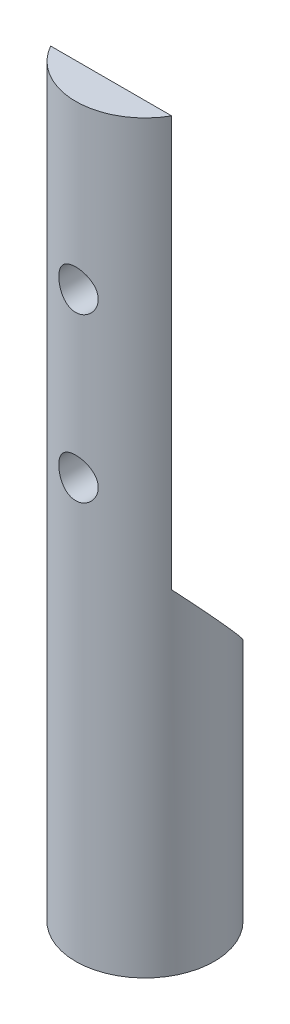
from build123d import *

# Parameters (mm, degrees)
SKETCH1_R               = 3.97129
BOSS_EXTRUDE1_DEPTH     = 42.672
CUT_EXTRUDE1_DEPTH      = 44.040003166
CUT_EXTRUDE1_DEPTH_BACK = 44.040003166
F_4_40_TAPPED_HOLE1_D   = 2.2606


with BuildPart() as part:
    # Sketch1 → Boss-Extrude1 (new body)
    with BuildSketch(Plane(origin=(0, 0, 0), x_dir=(1, 0, 0), z_dir=(0, 1, 0))):
        Circle(SKETCH1_R)
    extrude(amount=BOSS_EXTRUDE1_DEPTH)

    # Sketch2 → Cut-Extrude1 (cut, two sides: drawn at the far end of the back side and taken through both)
    with BuildSketch(Plane(origin=(0, 0, 0), x_dir=(0, 0, -1), z_dir=(1, 0, 0)).offset(-CUT_EXTRUDE1_DEPTH_BACK)):
        Polygon((-1.93929, 47.484126656), (-1.93929, 19.160593828), (3.97129, 12.7), (3.97129, 47.484126656), align=None)
    extrude(amount=CUT_EXTRUDE1_DEPTH + CUT_EXTRUDE1_DEPTH_BACK, mode=Mode.SUBTRACT)

    # #4-40 Tapped Hole1 (through all)
    with Locations(Plane(origin=(0, 0, 1.93929), x_dir=(-1, 0, 0), z_dir=(0, 0, -1))):
        with Locations((0, 23.992), (0, 33.332)):
            Hole(F_4_40_TAPPED_HOLE1_D / 2)


solid = part.part
